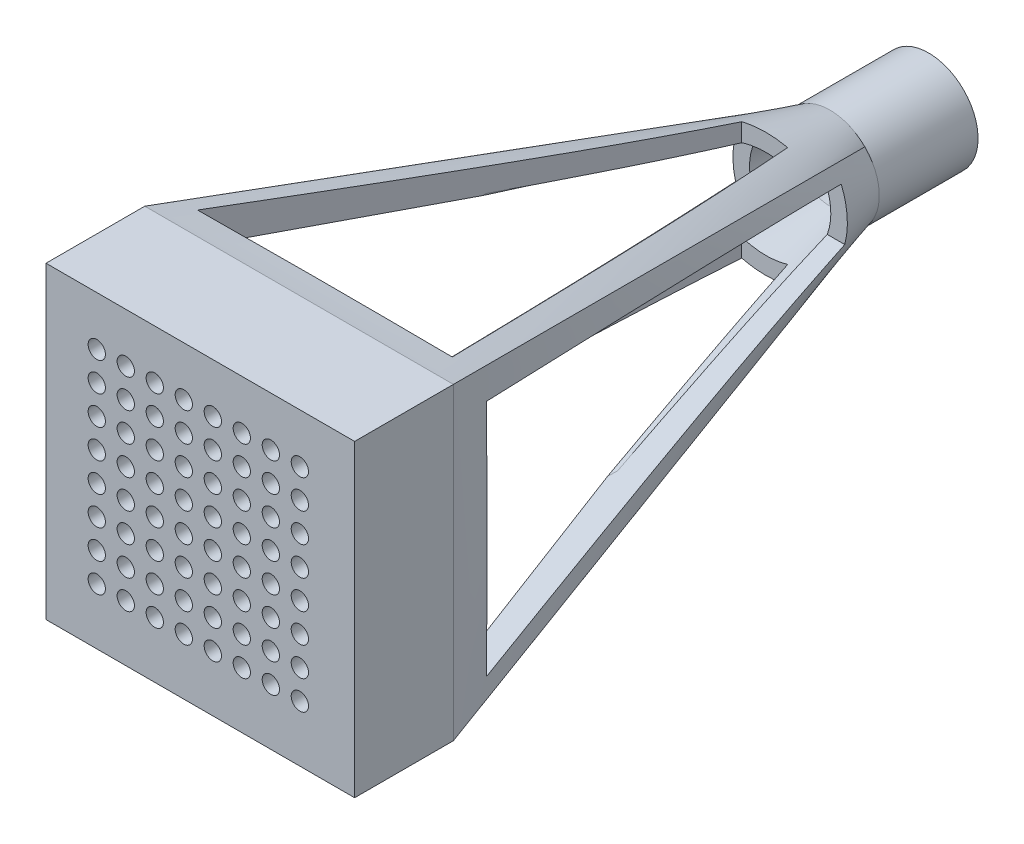
from build123d import *

# Parameters (mm, degrees)
SKETCH4_W           = 25
SKETCH4_H           = 25
BOSS_EXTRUDE1_DEPTH = 8
SKETCH5_R           = 0.7
CUT_EXTRUDE1_DEPTH  = 8
SKETCH6_R           = 4
SKETCH6_R_2         = 2.75
BOSS_EXTRUDE2_DEPTH = 8
CUT_EXTRUDE2_DEPTH  = 58
CUT_EXTRUDE3_DEPTH  = 58
CUT_EXTRUDE4_DEPTH  = 58
CUT_EXTRUDE5_DEPTH  = 58


with BuildPart() as part:
    # Loft1: read off the stored shape, not the designer's step
    # Loft1: loft between two sections, ruled curve by curve
    loft1_from = [
        Edge.make_bspline([(-12.5, 12.5, 43), (-10.416666667, 12.5, 43), (-8.333333333, 12.5, 43), (-4.166666667, 12.5, 43), (-2.083333333, 12.5, 43), (2.083333333, 12.5, 43), (4.166666667, 12.5, 43), (8.333333333, 12.5, 43), (10.416666667, 12.5, 43), (12.5, 12.5, 43)], [0, 0, 0, 0, 0.25, 0.25, 0.5, 0.5, 0.75, 0.75, 1, 1, 1, 1], 3),
        Edge.make_bspline([(12.5, 12.5, 43), (12.5, 10.416666667, 43), (12.5, 8.333333333, 43), (12.5, 4.166666667, 43), (12.5, 2.083333333, 43), (12.5, -2.083333333, 43), (12.5, -4.166666667, 43), (12.5, -8.333333333, 43), (12.5, -10.416666667, 43), (12.5, -12.5, 43)], [0, 0, 0, 0, 0.25, 0.25, 0.5, 0.5, 0.75, 0.75, 1, 1, 1, 1], 3),
        Edge.make_bspline([(-12.5, -12.5, 43), (-12.5, -10.416666667, 43), (-12.5, -8.333333333, 43), (-12.5, -4.166666667, 43), (-12.5, -2.083333333, 43), (-12.5, 2.083333333, 43), (-12.5, 4.166666667, 43), (-12.5, 8.333333333, 43), (-12.5, 10.416666667, 43), (-12.5, 12.5, 43)], [0, 0, 0, 0, 0.25, 0.25, 0.5, 0.5, 0.75, 0.75, 1, 1, 1, 1], 3),
        Edge.make_bspline([(12.5, -12.5, 43), (10.416666667, -12.5, 43), (8.333333333, -12.5, 43), (4.166666667, -12.5, 43), (2.083333333, -12.5, 43), (-2.083333333, -12.5, 43), (-4.166666667, -12.5, 43), (-8.333333333, -12.5, 43), (-10.416666667, -12.5, 43), (-12.5, -12.5, 43)], [0, 0, 0, 0, 0.25, 0.25, 0.5, 0.5, 0.75, 0.75, 1, 1, 1, 1], 3),
    ]
    loft1_to = [
        Edge.make_bspline([(-2.828427125, 2.828427125, 0), (-2.495093791, 3.161760458, 0), (-2.07471777, 3.460634385, 0), (-1.10270101, 3.881300639, 0), (-0.55228475, 4, 0), (0.55228475, 4, 0), (1.10270101, 3.881300639, 0), (2.07471777, 3.460634385, 0), (2.495093791, 3.161760458, 0), (2.828427125, 2.828427125, 0)], [0, 0, 0, 0, 0.25, 0.25, 0.5, 0.5, 0.75, 0.75, 1, 1, 1, 1], 3),
        Edge.make_bspline([(2.828427125, 2.828427125, 0), (3.161760458, 2.495093791, 0), (3.460634385, 2.07471777, 0), (3.881300639, 1.10270101, 0), (4, 0.55228475, 0), (4, -0.55228475, 0), (3.881300639, -1.10270101, 0), (3.460634385, -2.07471777, 0), (3.161760458, -2.495093791, 0), (2.828427125, -2.828427125, 0)], [0, 0, 0, 0, 0.25, 0.25, 0.5, 0.5, 0.75, 0.75, 1, 1, 1, 1], 3),
        Edge.make_bspline([(-2.828427125, -2.828427125, 0), (-3.161760458, -2.495093791, 0), (-3.460634385, -2.07471777, 0), (-3.881300639, -1.10270101, 0), (-4, -0.55228475, 0), (-4, 0.55228475, 0), (-3.881300639, 1.10270101, 0), (-3.460634385, 2.07471777, 0), (-3.161760458, 2.495093791, 0), (-2.828427125, 2.828427125, 0)], [0, 0, 0, 0, 0.25, 0.25, 0.5, 0.5, 0.75, 0.75, 1, 1, 1, 1], 3),
        Edge.make_bspline([(2.828427125, -2.828427125, 0), (2.495093791, -3.161760458, 0), (2.07471777, -3.460634385, 0), (1.10270101, -3.881300639, 0), (0.55228475, -4, 0), (-0.55228475, -4, 0), (-1.10270101, -3.881300639, 0), (-2.07471777, -3.460634385, 0), (-2.495093791, -3.161760458, 0), (-2.828427125, -2.828427125, 0)], [0, 0, 0, 0, 0.25, 0.25, 0.5, 0.5, 0.75, 0.75, 1, 1, 1, 1], 3),
    ]
    loft1 = Solid(Shell([*[Face.make_surface_from_curves(loft1_from[k], loft1_to[k]) for k in range(4)], Face(Wire(loft1_from)), Face(Wire(loft1_to))]))
    add(loft1)

    # Cut-Loft1: read off the stored shape, not the designer's step
    # Cut-Loft1: loft between two sections, ruled curve by curve
    cut_loft1_from = [
        Edge.make_bspline([(-1.944543648, -1.944543648, 0), (-1.715376982, -2.173710315, 0), (-1.426368467, -2.37918614, 0), (-0.758106945, -2.668394189, 0), (-0.379695766, -2.75, 0), (0.379695766, -2.75, 0), (0.758106945, -2.668394189, 0), (1.426368467, -2.37918614, 0), (1.715376982, -2.173710315, 0), (1.944543648, -1.944543648, 0)], [0, 0, 0, 0, 0.25, 0.25, 0.5, 0.5, 0.75, 0.75, 1, 1, 1, 1], 3),
        Edge.make_bspline([(1.944543648, -1.944543648, 0), (2.173710315, -1.715376982, 0), (2.37918614, -1.426368467, 0), (2.668394189, -0.758106945, 0), (2.75, -0.379695766, 0), (2.75, 0.379695766, 0), (2.668394189, 0.758106945, 0), (2.37918614, 1.426368467, 0), (2.173710315, 1.715376982, 0), (1.944543648, 1.944543648, 0)], [0, 0, 0, 0, 0.25, 0.25, 0.5, 0.5, 0.75, 0.75, 1, 1, 1, 1], 3),
        Edge.make_bspline([(-1.944543648, 1.944543648, 0), (-2.173710315, 1.715376982, 0), (-2.37918614, 1.426368467, 0), (-2.668394189, 0.758106945, 0), (-2.75, 0.379695766, 0), (-2.75, -0.379695766, 0), (-2.668394189, -0.758106945, 0), (-2.37918614, -1.426368467, 0), (-2.173710315, -1.715376982, 0), (-1.944543648, -1.944543648, 0)], [0, 0, 0, 0, 0.25, 0.25, 0.5, 0.5, 0.75, 0.75, 1, 1, 1, 1], 3),
        Edge.make_bspline([(1.944543648, 1.944543648, 0), (1.715376982, 2.173710315, 0), (1.426368467, 2.37918614, 0), (0.758106945, 2.668394189, 0), (0.379695766, 2.75, 0), (-0.379695766, 2.75, 0), (-0.758106945, 2.668394189, 0), (-1.426368467, 2.37918614, 0), (-1.715376982, 2.173710315, 0), (-1.944543648, 1.944543648, 0)], [0, 0, 0, 0, 0.25, 0.25, 0.5, 0.5, 0.75, 0.75, 1, 1, 1, 1], 3),
    ]
    cut_loft1_to = [
        Edge.make_bspline([(-10, -10, 43), (-8.333333333, -10, 43), (-6.666666667, -10, 43), (-3.333333333, -10, 43), (-1.666666667, -10, 43), (1.666666667, -10, 43), (3.333333333, -10, 43), (6.666666667, -10, 43), (8.333333333, -10, 43), (10, -10, 43)], [0, 0, 0, 0, 0.25, 0.25, 0.5, 0.5, 0.75, 0.75, 1, 1, 1, 1], 3),
        Edge.make_bspline([(10, -10, 43), (10, -8.333333333, 43), (10, -6.666666667, 43), (10, -3.333333333, 43), (10, -1.666666667, 43), (10, 1.666666667, 43), (10, 3.333333333, 43), (10, 6.666666667, 43), (10, 8.333333333, 43), (10, 10, 43)], [0, 0, 0, 0, 0.25, 0.25, 0.5, 0.5, 0.75, 0.75, 1, 1, 1, 1], 3),
        Edge.make_bspline([(-10, 10, 43), (-10, 8.333333333, 43), (-10, 6.666666667, 43), (-10, 3.333333333, 43), (-10, 1.666666667, 43), (-10, -1.666666667, 43), (-10, -3.333333333, 43), (-10, -6.666666667, 43), (-10, -8.333333333, 43), (-10, -10, 43)], [0, 0, 0, 0, 0.25, 0.25, 0.5, 0.5, 0.75, 0.75, 1, 1, 1, 1], 3),
        Edge.make_bspline([(10, 10, 43), (8.333333333, 10, 43), (6.666666667, 10, 43), (3.333333333, 10, 43), (1.666666667, 10, 43), (-1.666666667, 10, 43), (-3.333333333, 10, 43), (-6.666666667, 10, 43), (-8.333333333, 10, 43), (-10, 10, 43)], [0, 0, 0, 0, 0.25, 0.25, 0.5, 0.5, 0.75, 0.75, 1, 1, 1, 1], 3),
    ]
    cut_loft1 = Solid(Shell([*[Face.make_surface_from_curves(cut_loft1_from[k], cut_loft1_to[k]) for k in range(4)], Face(Wire(cut_loft1_from)), Face(Wire(cut_loft1_to))]))
    add(cut_loft1, mode=Mode.SUBTRACT)

    # Sketch4 → Boss-Extrude1 (add)
    with BuildSketch(Plane.XY.offset(43)):
        Rectangle(SKETCH4_W, SKETCH4_H)
    extrude(amount=BOSS_EXTRUDE1_DEPTH)

    # Sketch5 → Cut-Extrude1 (cut)
    with BuildSketch(Plane.XY.offset(43)):
        with Locations((-8.388056057, 8.509622087)):
            Circle(SKETCH5_R)
        with Locations((-6.038056057, 8.509622087)):
            Circle(SKETCH5_R)
        with Locations((-3.688056057, 8.509622087)):
            Circle(SKETCH5_R)
        with Locations((-1.338056057, 8.509622087)):
            Circle(SKETCH5_R)
        with Locations((1.011943943, 8.509622087)):
            Circle(SKETCH5_R)
        with Locations((3.361943943, 8.509622087)):
            Circle(SKETCH5_R)
        with Locations((5.711943943, 8.509622087)):
            Circle(SKETCH5_R)
        with Locations((8.061943943, 8.509622087)):
            Circle(SKETCH5_R)
        with Locations((-6.038056057, 6.159622087)):
            Circle(SKETCH5_R)
        with Locations((-3.688056057, 6.159622087)):
            Circle(SKETCH5_R)
        with Locations((-1.338056057, 6.159622087)):
            Circle(SKETCH5_R)
        with Locations((1.011943943, 6.159622087)):
            Circle(SKETCH5_R)
        with Locations((3.361943943, 6.159622087)):
            Circle(SKETCH5_R)
        with Locations((5.711943943, 6.159622087)):
            Circle(SKETCH5_R)
        with Locations((8.061943943, 6.159622087)):
            Circle(SKETCH5_R)
        with Locations((-6.038056057, 3.809622087)):
            Circle(SKETCH5_R)
        with Locations((-3.688056057, 3.809622087)):
            Circle(SKETCH5_R)
        with Locations((-1.338056057, 3.809622087)):
            Circle(SKETCH5_R)
        with Locations((1.011943943, 3.809622087)):
            Circle(SKETCH5_R)
        with Locations((3.361943943, 3.809622087)):
            Circle(SKETCH5_R)
        with Locations((5.711943943, 3.809622087)):
            Circle(SKETCH5_R)
        with Locations((8.061943943, 3.809622087)):
            Circle(SKETCH5_R)
        with Locations((-6.038056057, 1.459622087)):
            Circle(SKETCH5_R)
        with Locations((-3.688056057, 1.459622087)):
            Circle(SKETCH5_R)
        with Locations((-1.338056057, 1.459622087)):
            Circle(SKETCH5_R)
        with Locations((1.011943943, 1.459622087)):
            Circle(SKETCH5_R)
        with Locations((3.361943943, 1.459622087)):
            Circle(SKETCH5_R)
        with Locations((5.711943943, 1.459622087)):
            Circle(SKETCH5_R)
        with Locations((8.061943943, 1.459622087)):
            Circle(SKETCH5_R)
        with Locations((-6.038056057, -0.890377913)):
            Circle(SKETCH5_R)
        with Locations((-3.688056057, -0.890377913)):
            Circle(SKETCH5_R)
        with Locations((-1.338056057, -0.890377913)):
            Circle(SKETCH5_R)
        with Locations((1.011943943, -0.890377913)):
            Circle(SKETCH5_R)
        with Locations((3.361943943, -0.890377913)):
            Circle(SKETCH5_R)
        with Locations((5.711943943, -0.890377913)):
            Circle(SKETCH5_R)
        with Locations((8.061943943, -0.890377913)):
            Circle(SKETCH5_R)
        with Locations((-6.038056057, -3.240377913)):
            Circle(SKETCH5_R)
        with Locations((-3.688056057, -3.240377913)):
            Circle(SKETCH5_R)
        with Locations((-1.338056057, -3.240377913)):
            Circle(SKETCH5_R)
        with Locations((1.011943943, -3.240377913)):
            Circle(SKETCH5_R)
        with Locations((3.361943943, -3.240377913)):
            Circle(SKETCH5_R)
        with Locations((5.711943943, -3.240377913)):
            Circle(SKETCH5_R)
        with Locations((8.061943943, -3.240377913)):
            Circle(SKETCH5_R)
        with Locations((-6.038056057, -5.590377913)):
            Circle(SKETCH5_R)
        with Locations((-3.688056057, -5.590377913)):
            Circle(SKETCH5_R)
        with Locations((-1.338056057, -5.590377913)):
            Circle(SKETCH5_R)
        with Locations((1.011943943, -5.590377913)):
            Circle(SKETCH5_R)
        with Locations((3.361943943, -5.590377913)):
            Circle(SKETCH5_R)
        with Locations((5.711943943, -5.590377913)):
            Circle(SKETCH5_R)
        with Locations((8.061943943, -5.590377913)):
            Circle(SKETCH5_R)
        with Locations((-6.038056057, -7.940377913)):
            Circle(SKETCH5_R)
        with Locations((-3.688056057, -7.940377913)):
            Circle(SKETCH5_R)
        with Locations((-1.338056057, -7.940377913)):
            Circle(SKETCH5_R)
        with Locations((1.011943943, -7.940377913)):
            Circle(SKETCH5_R)
        with Locations((3.361943943, -7.940377913)):
            Circle(SKETCH5_R)
        with Locations((5.711943943, -7.940377913)):
            Circle(SKETCH5_R)
        with Locations((8.061943943, -7.940377913)):
            Circle(SKETCH5_R)
        with Locations((-8.388056057, 6.159622087)):
            Circle(SKETCH5_R)
        with Locations((-8.388056057, 3.809622087)):
            Circle(SKETCH5_R)
        with Locations((-8.388056057, 1.459622087)):
            Circle(SKETCH5_R)
        with Locations((-8.388056057, -0.890377913)):
            Circle(SKETCH5_R)
        with Locations((-8.388056057, -3.240377913)):
            Circle(SKETCH5_R)
        with Locations((-8.388056057, -5.590377913)):
            Circle(SKETCH5_R)
        with Locations((-8.388056057, -7.940377913)):
            Circle(SKETCH5_R)
    extrude(amount=CUT_EXTRUDE1_DEPTH, mode=Mode.SUBTRACT)

    # Sketch6 → Boss-Extrude2 (add)
    with BuildSketch(Plane(origin=(0, 0, 0), x_dir=(-1, 0, 0), z_dir=(0, 0, -1))):
        with Locations(Location((0, 0, 0), (0, 0, 135))):
            Circle(SKETCH6_R)
        with Locations(Location((0, 0, 0), (0, 0, 225))):
            Circle(SKETCH6_R_2, mode=Mode.SUBTRACT)
    extrude(amount=BOSS_EXTRUDE2_DEPTH)

    # Sketch7 → Cut-Extrude2 (cut)
    with BuildSketch(Plane(origin=(0, 0, 0), x_dir=(1, 0, 0), z_dir=(0, 1, 0))):
        Polygon((-1.965717978, -5.179711055), (1.757861177, -5.179711055), (10.010117682, -40.604031661), (-10.620523581, -40.604031661), align=None)
    extrude(amount=-CUT_EXTRUDE2_DEPTH, mode=Mode.SUBTRACT)

    # Sketch7<3> → Cut-Extrude3 (cut)
    with BuildSketch(Plane(origin=(0, 0, 0), x_dir=(1, 0, 0), z_dir=(0, 1, 0))):
        Polygon((-1.965717978, -5.179711055), (1.757861177, -5.179711055), (10.010117682, -40.604031661), (-10.620523581, -40.604031661), align=None)
    extrude(amount=CUT_EXTRUDE3_DEPTH, mode=Mode.SUBTRACT)

    # Sketch8 → Cut-Extrude4 (cut)
    with BuildSketch(Plane(origin=(0, 0, 0), x_dir=(0, 0, -1), z_dir=(1, 0, 0))):
        Polygon((-3.220235662, 2.475386447), (-3.220235662, -1.618521908), (-39.589374996, -10.091960129), (-39.589374996, 9.23509559), align=None)
    extrude(amount=-CUT_EXTRUDE4_DEPTH, mode=Mode.SUBTRACT)

    # Sketch8<3> → Cut-Extrude5 (cut)
    with BuildSketch(Plane(origin=(0, 0, 0), x_dir=(0, 0, -1), z_dir=(1, 0, 0))):
        Polygon((-3.220235662, 2.475386447), (-3.220235662, -1.618521908), (-39.589374996, -10.091960129), (-39.589374996, 9.23509559), align=None)
    extrude(amount=CUT_EXTRUDE5_DEPTH, mode=Mode.SUBTRACT)


solid = part.part
